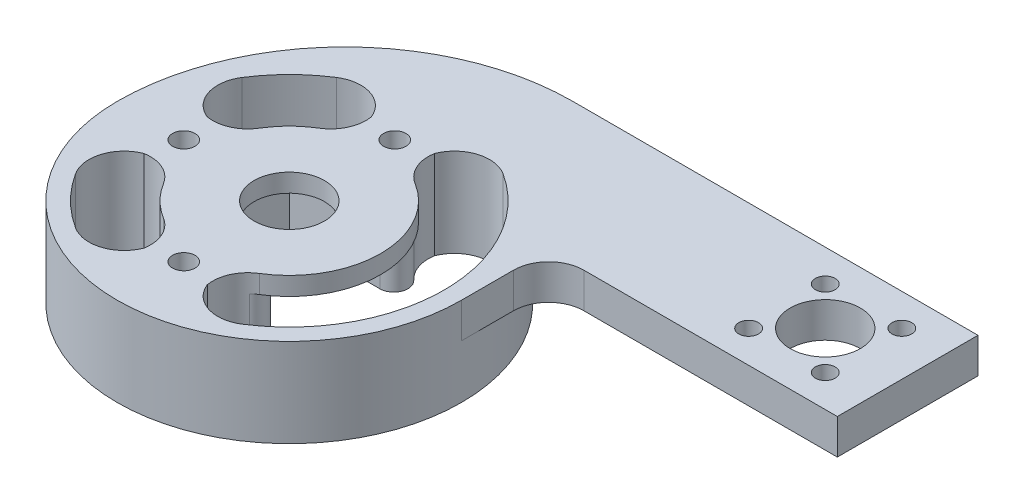
from build123d import *

# Parameters (mm, degrees)
SKETCH1_R           = 31.0896
BOSS_EXTRUDE1_DEPTH = 16.002
BOSS_EXTRUDE2_START = -6.35
BOSS_EXTRUDE2_DEPTH = 6.35
FILLET2_R           = 6.35
CUT_EXTRUDE2_REACH  = 96.198
SKETCH4_R           = 1.778
SKETCH4_R_2         = 6.35
SKETCH7_R           = 2.0193
CUT_EXTRUDE4_DEPTH  = 95.197625109
FILLET7_R           = 6.35
FILLET8_R           = 41.148
CUT_EXTRUDE5_DEPTH  = 12.7
FILLET9_R           = 2.54
SKETCH9_R           = 6.35
CUT_EXTRUDE6_DEPTH  = 3.302


# Some blends are built 0.0001 mm under size
with BuildPart() as part:
    # Sketch1 → Boss-Extrude1 (new body)
    with BuildSketch(Plane(origin=(0, 0, 0), x_dir=(1, 0, 0), z_dir=(0, 1, 0))):
        with Locations(Location((0, 0, 0), (0, 0, 270))):
            Circle(SKETCH1_R)
    extrude(amount=BOSS_EXTRUDE1_DEPTH)

    # Sketch2 → Boss-Extrude2 (add)
    with BuildSketch(Plane(origin=(0, 16.002, 0), x_dir=(1, 0, 0), z_dir=(0, 1, 0)).offset(BOSS_EXTRUDE2_START)):
        with BuildLine():
            Line((-31.0896, 0), (-31.0896, 41.148))
            Line((-31.0896, 41.148), (83.2104, 41.148))
            Line((83.2104, 41.148), (83.2104, 15.748))
            Line((83.2104, 15.748), (31.0896, 15.748))
            Line((31.0896, 15.748), (31.0896, 0))
            ThreePointArc((31.0896, 0), (0, -31.0896), (-31.0896, 0))
        make_face()
    extrude(amount=BOSS_EXTRUDE2_DEPTH)

    # Fillet2
    fillet2_edges = [part.edges().sort_by_distance(p)[0] for p in [
        (31.0896, 12.827, -15.748),
    ]]
    fillet(fillet2_edges, radius=FILLET2_R)

    # Sketch4 → Cut-Extrude2 (cut, up to next)
    with BuildSketch(Plane(origin=(0, 16.002, 0), x_dir=(1, 0, 0), z_dir=(0, 1, 0)), mode=Mode.PRIVATE) as cut_extrude2_sk1:
        with Locations(Location((61.411202787, 35.362797213, 0), (0, 0, 270))):
            Circle(SKETCH4_R)
    cut_extrude2_tool1 = extrude(cut_extrude2_sk1.sketch, amount=-CUT_EXTRUDE2_REACH, mode=Mode.PRIVATE) & part.part
    # Sketch4 → Cut-Extrude2 (cut, up to next)
    with BuildSketch(Plane(origin=(0, 16.002, 0), x_dir=(1, 0, 0), z_dir=(0, 1, 0)), mode=Mode.PRIVATE) as cut_extrude2_sk2:
        with Locations(Location((75.240797213, 35.362797213, 0), (0, 0, 270))):
            Circle(SKETCH4_R)
    cut_extrude2_tool2 = extrude(cut_extrude2_sk2.sketch, amount=-CUT_EXTRUDE2_REACH, mode=Mode.PRIVATE) & part.part
    # Sketch4 → Cut-Extrude2 (cut, up to next)
    with BuildSketch(Plane(origin=(0, 16.002, 0), x_dir=(1, 0, 0), z_dir=(0, 1, 0)), mode=Mode.PRIVATE) as cut_extrude2_sk3:
        with Locations(Location((75.240797213, 21.533202787, 0), (0, 0, 270))):
            Circle(SKETCH4_R)
    cut_extrude2_tool3 = extrude(cut_extrude2_sk3.sketch, amount=-CUT_EXTRUDE2_REACH, mode=Mode.PRIVATE) & part.part
    # Sketch4 → Cut-Extrude2 (cut, up to next)
    with BuildSketch(Plane(origin=(0, 16.002, 0), x_dir=(1, 0, 0), z_dir=(0, 1, 0)), mode=Mode.PRIVATE) as cut_extrude2_sk4:
        with Locations(Location((68.326, 28.448, 0), (0, 0, 270))):
            Circle(SKETCH4_R_2)
    cut_extrude2_tool4 = extrude(cut_extrude2_sk4.sketch, amount=-CUT_EXTRUDE2_REACH, mode=Mode.PRIVATE) & part.part
    # Sketch4 → Cut-Extrude2 (cut, up to next)
    with BuildSketch(Plane(origin=(0, 16.002, 0), x_dir=(1, 0, 0), z_dir=(0, 1, 0)), mode=Mode.PRIVATE) as cut_extrude2_sk5:
        with Locations(Location((61.411202787, 21.533202787, 0), (0, 0, 270))):
            Circle(SKETCH4_R)
    cut_extrude2_tool5 = extrude(cut_extrude2_sk5.sketch, amount=-CUT_EXTRUDE2_REACH, mode=Mode.PRIVATE) & part.part
    add(cut_extrude2_tool1.solids().sort_by_distance((61.411203, 16.002, -35.362797))[0], mode=Mode.SUBTRACT)
    add(cut_extrude2_tool2.solids().sort_by_distance((75.240797, 16.002, -35.362797))[0], mode=Mode.SUBTRACT)
    add(cut_extrude2_tool3.solids().sort_by_distance((75.240797, 16.002, -21.533203))[0], mode=Mode.SUBTRACT)
    add(cut_extrude2_tool4.solids().sort_by_distance((68.326, 16.002, -28.448))[0], mode=Mode.SUBTRACT)
    add(cut_extrude2_tool5.solids().sort_by_distance((61.411203, 16.002, -21.533203))[0], mode=Mode.SUBTRACT)

    # Sketch7 → Cut-Extrude4 (cut, through all)
    with BuildSketch(Plane(origin=(0, 0, 0), x_dir=(1, 0, 0), z_dir=(0, 1, 0))):
        with BuildLine():
            ThreePointArc((27.94, 0), (22.235278576, 16.918510179), (7.450666667, 26.928259621))
            Line((7.450666667, 26.928259621), (4.402666667, 15.912153412))
            ThreePointArc((4.402666667, 15.912153412), (13.139028249, 9.997301469), (16.51, 0))
            ThreePointArc((16.51, 0), (13.139028249, -9.997301469), (4.402666667, -15.912153412))
            Line((4.402666667, -15.912153412), (7.450666667, -26.928259621))
            ThreePointArc((7.450666667, -26.928259621), (22.235278576, -16.918510179), (27.94, 0))
        make_face()
        with BuildLine():
            Line((-15.912153412, -4.402666667), (-26.928259621, -7.450666667))
            ThreePointArc((-26.928259621, -7.450666667), (-19.756563466, -19.756563466), (-7.450666667, -26.928259621))
            Line((-7.450666667, -26.928259621), (-4.402666667, -15.912153412))
            ThreePointArc((-4.402666667, -15.912153412), (-11.674332957, -11.674332957), (-15.912153412, -4.402666667))
        make_face()
        with BuildLine():
            Line((-4.402666667, 15.912153412), (-7.450666667, 26.928259621))
            ThreePointArc((-7.450666667, 26.928259621), (-19.756563466, 19.756563466), (-26.928259621, 7.450666667))
            Line((-26.928259621, 7.450666667), (-15.912153412, 4.402666667))
            ThreePointArc((-15.912153412, 4.402666667), (-11.674332957, 11.674332957), (-4.402666667, 15.912153412))
        make_face()
        with Locations(Location((-19.05, 0, 0), (0, 0, 270))):
            Circle(SKETCH7_R)
        with Locations(Location((0, -19.05, 0), (0, 0, 270))):
            Circle(SKETCH7_R)
        with Locations(Location((0, 19.05, 0), (0, 0, 270))):
            Circle(SKETCH7_R)
    extrude(amount=CUT_EXTRUDE4_DEPTH, mode=Mode.SUBTRACT)

    # Fillet7
    # the kernel refuses this fillet: 6.35 mm, written as the material it adds along each edge
    with BuildSketch(Plane(origin=(-26.928259621, 0, -7.450666667), x_dir=(0.40702884348062, 0, -0.9134153056385845), z_dir=(0, 1, 0)), Plane(origin=(-7.450666667, 0, 26.928259621), x_dir=(-0.9134153056385848, 0, -0.40702884348061963), z_dir=(0, 1, 0))) as fillet7_piece_1:
        with BuildLine():
            CenterArc((7.365726845, -6.279391075), FILLET7_R, 81.447682412, 107.104635177)
            Line((1.086335771, -7.223715029), (0, 0))
            ThreePointArc((0, 0), (4.1550254, 0.310679271), (8.3100508, 0))
        make_face()
    extrude(amount=16.002)
    with BuildSketch(Plane(origin=(-7.450666667, 0, -26.928259621), x_dir=(0.26666666666666705, 0, 0.9637888196533972), z_dir=(0, 1, 0)), Plane(origin=(7.450666667, 0, 26.928259621), x_dir=(-0.26666666666666733, 0, -0.9637888196533971), z_dir=(0, 1, 0)), Plane(origin=(-26.928259621, 0, 7.450666667), x_dir=(0.9637888196533975, 0, -0.26666666666666644), z_dir=(0, 1, 0))) as fillet7_piece_2:
        with BuildLine():
            CenterArc((7.304942452, -6.35), FILLET7_R, 90, 107.104635177)
            ThreePointArc((1.235807879, -8.217647059), (0.310679271, -4.1550254), (0, 0))
            Line((0, 0), (7.304942452, 0))
        make_face()
    extrude(amount=16.002)
    with BuildSketch(Plane(origin=(-4.402666667, 0, -15.912153412), x_dir=(-0.916852417954672, 0, 0.39922630636103035), z_dir=(0, 1, 0)), Plane(origin=(4.402666667, 0, 15.912153412), x_dir=(0.9168524179546733, 0, -0.39922630636102746), z_dir=(0, 1, 0)), Plane(origin=(-15.912153412, 0, 4.402666667), x_dir=(0.39922630636102946, 0, 0.9168524179546725), z_dir=(0, 1, 0))) as fillet7_piece_3:
        with BuildLine():
            CenterArc((5.522661099, -6.287214109), FILLET7_R, 98.063810107, 73.872379787)
            Line((-0.76455301, -5.396462319), (0, 0))
            ThreePointArc((0, 0), (2.315954654, -0.163243317), (4.631909309, 0))
        make_face()
    extrude(amount=16.002)
    with BuildSketch(Plane(origin=(4.402666667, 0, -15.912153412), x_dir=(0.26666666666666416, 0, -0.9637888196533979), z_dir=(0, 1, 0))) as fillet7_piece_4:
        with BuildLine():
            CenterArc((5.450352912, -6.35), FILLET7_R, 90, 73.872379787)
            ThreePointArc((-0.649745119, -4.586111111), (-0.163243317, -2.315954654), (0, 0))
            Line((0, 0), (5.450352912, 0))
        make_face()
    extrude(amount=16.002)
    with BuildSketch(Plane(origin=(7.450666667, 0, -26.928259621), x_dir=(-0.2666666666666666, 0, 0.9637888196533974), z_dir=(0, 1, 0))) as fillet7_piece_5:
        with BuildLine():
            CenterArc((7.304942452, 6.35), FILLET7_R, 162.895364823, 107.104635177)
            ThreePointArc((1.235807879, 8.217647059), (0.310679271, 4.1550254), (0, 0))
            Line((0, 0), (7.304942452, 0))
        make_face()
    extrude(amount=16.002)
    with BuildSketch(Plane(origin=(-4.402666667, 0, 15.912153412), x_dir=(-0.9168524179546729, 0, -0.3992263063610288), z_dir=(0, 1, 0)), Plane(origin=(-15.912153412, 0, -4.402666667), x_dir=(0.39922630636102996, 0, -0.9168524179546723), z_dir=(0, 1, 0))) as fillet7_piece_6:
        with BuildLine():
            CenterArc((5.522661099, 6.287214109), FILLET7_R, 188.063810107, 73.872379787)
            Line((-0.76455301, 5.396462319), (0, 0))
            ThreePointArc((0, 0), (2.315954654, 0.163243317), (4.631909309, 0))
        make_face()
    extrude(amount=16.002)

    # Fillet8
    fillet8_edges = [part.edges().sort_by_distance(p)[0] for p in [
        (-31.0896, 12.827, -41.148),
    ]]
    fillet(fillet8_edges, radius=FILLET8_R - 0.0001)  # a hair under: the kernel refuses the full size

    # Sketch8 → Cut-Extrude5 (cut)
    with BuildSketch(Plane.XZ):
        with BuildLine():
            Line((-10.414, 10.414), (10.414, 10.414))
            ThreePointArc((10.414, 10.414), (20.828, 0), (10.414, -10.414))
            Line((10.414, -10.414), (-10.414, -10.414))
            Line((-10.414, -10.414), (-10.414, 10.414))
        make_face()
    extrude(amount=-CUT_EXTRUDE5_DEPTH, mode=Mode.SUBTRACT)

    # Fillet9
    # the kernel refuses this fillet: 2.54 mm, written as the material it takes off along each edge
    with BuildSketch(Plane(origin=(13.087195122, 12.7, 10.065059555), x_dir=(-0.7525451578932851, 0, 0.658540648199768), z_dir=(0, -1, 0))) as fillet9_piece_1:
        with BuildLine():
            CenterArc((7.288242174, 2.538935053), FILLET9_R, 131.188669075, 137.152126286)
            Line((5.615548928, 4.450399754), (5.448279603, 4.641546224))
            ThreePointArc((5.448279603, 4.641546224), (2.074222188, 1.688960676), (-0.1125988, 0.227678524))
            Line((-0.1125988, 0.227678524), (-0.049545453, -0.249120951))
            ThreePointArc((-0.049545453, -0.249120951), (6.014734512, -0.336617786), (7.207343199, -0.253893505))
            Line((7.207343199, -0.253893505), (7.214697651, 0))
        make_face()
    extrude(amount=30.736744128, mode=Mode.SUBTRACT)
    with BuildSketch(Plane(origin=(13.087195122, 12.7, -10.065059555), x_dir=(-0.7525451578933744, 0, -0.658540648199666), z_dir=(0, -1, 0))) as fillet9_piece_2:
        with BuildLine():
            CenterArc((7.288242174, -2.538935053), FILLET9_R, 91.659204639, 137.152126286)
            Line((5.615548928, -4.450399754), (5.448279603, -4.641546224))
            ThreePointArc((5.448279603, -4.641546224), (2.074222188, -1.688960676), (-0.1125988, -0.227678524))
            Line((-0.1125988, -0.227678524), (-0.049545453, 0.249120951))
            ThreePointArc((-0.049545453, 0.249120951), (6.014734512, 0.336617786), (7.207343199, 0.253893505))
            Line((7.207343199, 0.253893505), (7.214697651, 0))
        make_face()
    extrude(amount=30.736744128, mode=Mode.SUBTRACT)

    # Sketch9 → Cut-Extrude6 (cut)
    with BuildSketch(Plane.XZ.offset(-12.7)):
        with Locations(Location((0, 0, 0), (0, 0, 270))):
            Circle(SKETCH9_R)
    extrude(amount=-CUT_EXTRUDE6_DEPTH, mode=Mode.SUBTRACT)


solid = part.part
